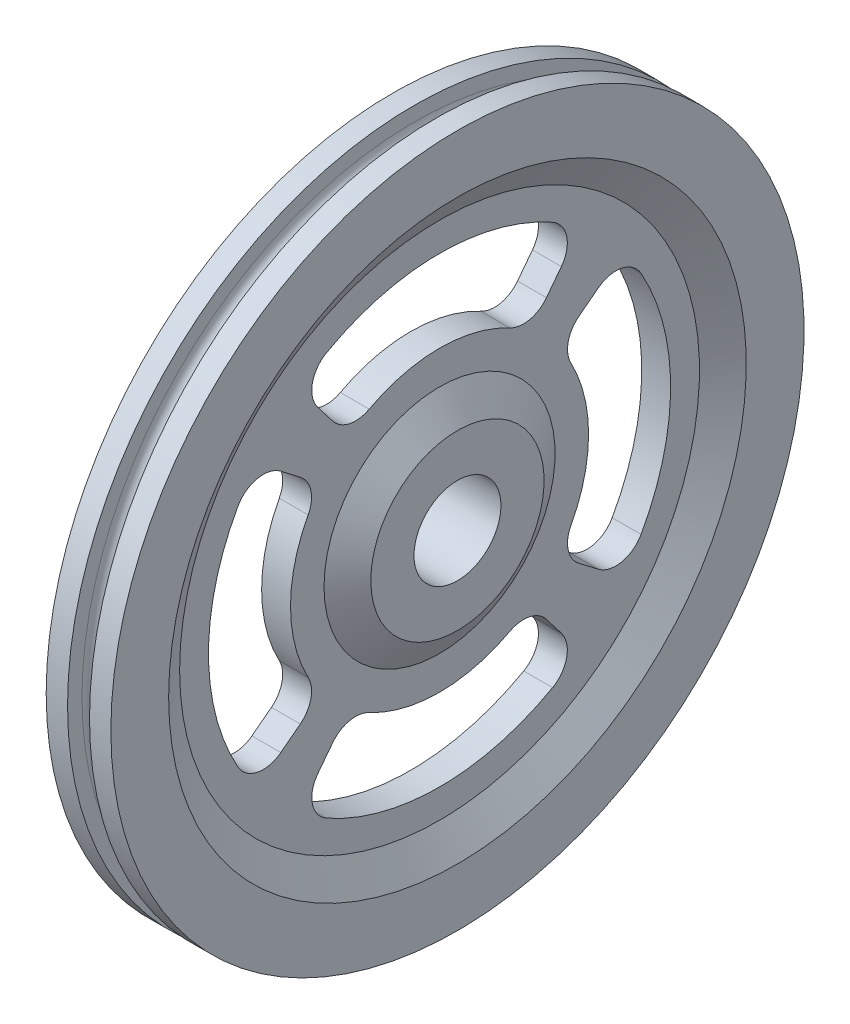
from build123d import *

# Parameters (mm, degrees)
CUT_EXTRUDE1_REACH = 110.253
CIRPATTERN1_COUNT  = 4


with BuildPart() as part:
    # Sketch1 → Revolve1 (revolve)
    with BuildSketch(Plane.XY):
        with BuildLine():
            Line((-7.112, 19.05), (-3.175, 25.4))
            Line((-3.175, 25.4), (-3.175, 57.15))
            Line((-3.175, 57.15), (-7.112, 63.5))
            Line((-7.112, 63.5), (-7.112, 76.2))
            Line((-7.112, 76.2), (-2.413, 76.2))
            Line((-2.413, 76.2), (-2.413, 73.025))
            ThreePointArc((-2.413, 73.025), (0, 70.612), (2.413, 73.025))
            Line((2.413, 73.025), (2.413, 76.2))
            Line((2.413, 76.2), (7.112, 76.2))
            Line((7.112, 76.2), (7.112, 63.5))
            Line((7.112, 63.5), (3.175, 57.15))
            Line((3.175, 57.15), (3.175, 25.4))
            Line((3.175, 25.4), (7.112, 19.05))
            Line((7.112, 19.05), (7.112, 9.55675))
            Line((7.112, 9.55675), (-7.112, 9.55675))
            Line((-7.112, 9.55675), (-7.112, 19.05))
        make_face()
    revolve(axis=Axis((0, 0, 0), (1, 0, 0)))

    # Sketch2 → Cut-Extrude1 (cut, up to next)
    with BuildSketch(Plane(origin=(3.175, 0, 0), x_dir=(0, 0, -1), z_dir=(1, 0, 0)), mode=Mode.PRIVATE) as cut_extrude1_sk1:
        with BuildLine():
            Line((23.49644805, 30.621167271), (26.781905408, 34.902858661))
            ThreePointArc((26.781905408, 34.902858661), (27.96426729, 40.046055634), (24.850413368, 44.306849983))
            ThreePointArc((24.850413368, 44.306849983), (0, 50.8), (-24.850413368, 44.306849983))
            ThreePointArc((-24.850413368, 44.306849983), (-27.96426729, 40.046055634), (-26.781905408, 34.902858661))
            Line((-26.781905408, 34.902858661), (-23.49644805, 30.621167271))
            ThreePointArc((-23.49644805, 30.621167271), (-19.797458156, 28.279540119), (-15.462119544, 28.888295471))
            ThreePointArc((-15.462119544, 28.888295471), (0, 32.766), (15.462119544, 28.888295471))
            ThreePointArc((15.462119544, 28.888295471), (19.797458156, 28.279540119), (23.49644805, 30.621167271))
        make_face()
    cut_extrude1_tool1 = extrude(cut_extrude1_sk1.sketch, amount=-CUT_EXTRUDE1_REACH, mode=Mode.PRIVATE) & part.part
    cut_extrude1 = cut_extrude1_tool1.solids().sort_by_distance((3.175, 39.616881, 0))[0]
    add(cut_extrude1, mode=Mode.SUBTRACT)

    # CirPattern1: Cut-Extrude1 ×4 about axis
    cirpattern1_axis = Axis((0, 0, 0), (-1, 0, 0))
    for i in range(1, CIRPATTERN1_COUNT):
        add(cut_extrude1.rotate(cirpattern1_axis, i * 360 / CIRPATTERN1_COUNT), mode=Mode.SUBTRACT)


solid = part.part
